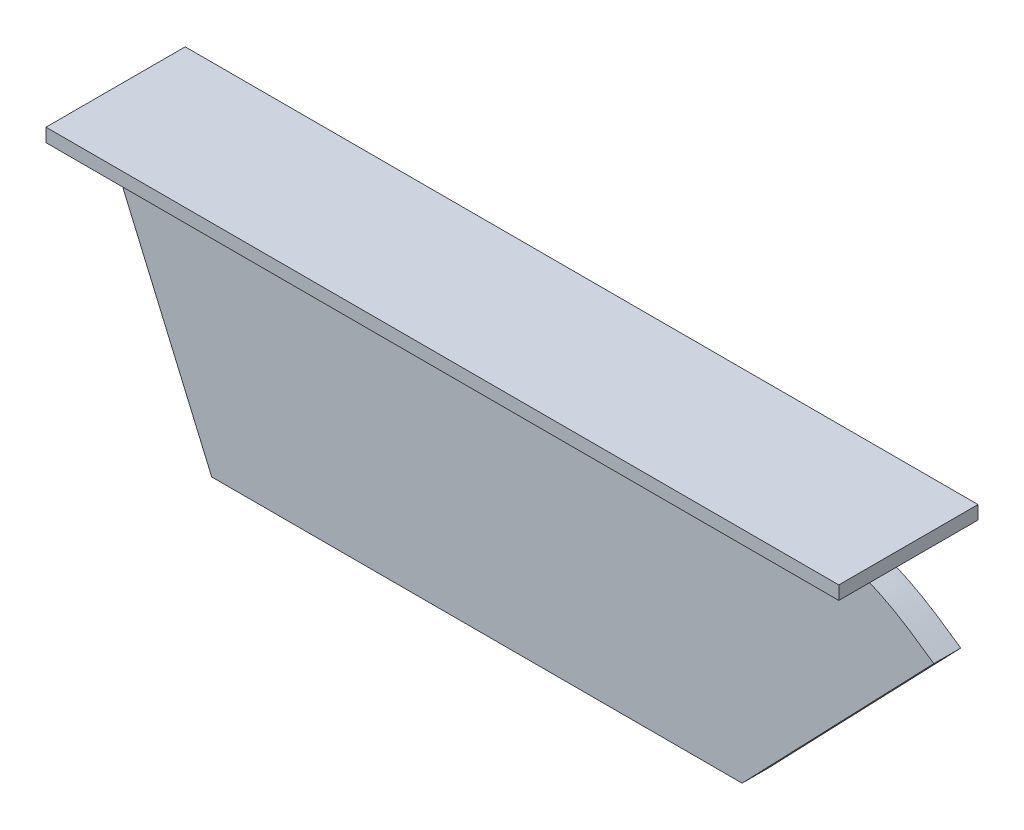
from build123d import *

# Parameters (mm, degrees)
EXTRUDE_1_DEPTH     = 1.2
CUT_EXTRUDE_START   = -1.2
CUT_EXTRUDE_1_DEPTH = 1.2
SKETCH_4_R          = 0.3
EXTRUDE_2_DEPTH     = 0.3
SKETCH_5_W          = 35.331764914
SKETCH_5_H          = 6.20328697
EXTRUDE_3_DEPTH     = 0.6


# Read off the part's stored shape, not the designer's step: Вырез-Вытянуть-Тонкостенный1
with BuildPart() as part:
    # Эскиз2 → Бобышка-Вытянуть1 (new body)
    with BuildSketch(Plane.XY):
        with BuildLine():
            Line((-18.718376773, 5.964639596), (-19.098029559, 5.834924894))
            Line((-19.098029559, 5.834924894), (-13.908113328, -6.217213911))
            Line((-13.908113328, -6.217213911), (10.163695982, -6.217213911))
            Line((10.163695982, -6.217213911), (19.098029559, 3.075246962))
            Line((19.098029559, 3.075246962), (18.818052215, 3.361181271))
            add(Edge.make_bspline(
                [(18.818052215, 3.361181271), (18.196335672, 3.797817809), (16.975433986, 4.6552669), (14.927683514, 5.553251977), (12.774537573, 6.124349252), (11.289757629, 6.1860932), (10.541386196, 6.217213911)],
                knots=[0, 0, 0, 0, 0.255164744, 0.501082157, 0.74853118, 1, 1, 1, 1], degree=3))
            Line((10.541386196, 6.217213911), (-16.231491208, 6.217213911))
            Line((-16.231491208, 6.217213911), (-18.718376773, 5.964639596))
        make_face()
    extrude(amount=EXTRUDE_1_DEPTH)

    # Вырез-Вытянуть-Тонкостенный1 outline → Вырез-Вытянуть-Тонкостенный1 (cut)
    with BuildSketch(Plane.XY.offset(1.2).offset(CUT_EXTRUDE_START)):
        with BuildLine():
            Line((19.098029559, 3.075246962), (18.818052215, 3.361181271))
            add(Edge.make_bspline(
                [(18.818052215, 3.361181271), (18.196335672, 3.797817809), (16.975433986, 4.6552669), (14.927683514, 5.553251977), (12.774537573, 6.124349252), (11.289757629, 6.1860932), (10.541386196, 6.217213911)],
                knots=[0, 0, 0, 0, 0.255164744, 0.501082157, 0.74853118, 1, 1, 1, 1], degree=3))
            Line((10.541386196, 6.217213911), (-16.231491208, 6.217213911))
            Line((-16.231491208, 6.217213911), (-18.718376773, 5.964639596))
            Line((-18.718376773, 5.964639596), (-19.098029559, 5.834924894))
            Line((-19.098029559, 5.834924894), (-13.908113328, -6.217213911))
            Line((-13.908113328, -6.217213911), (10.163695982, -6.217213911))
            Line((10.163695982, -6.217213911), (19.098029559, 3.075246962))
        make_face()
        with BuildLine():
            add(Edge.make_bspline(
                [(18.537521774, 3.069405939), (17.947435083, 3.483762917), (17.356771233, 3.89722808), (16.097834512, 4.604238585), (15.441178256, 4.89047439), (14.096932161, 5.359287166), (13.40761017, 5.542927998), (11.977353684, 5.757866724), (11.254825306, 5.787199054), (10.533072773, 5.817213911)],
                knots=[0, 0, 0, 0, 0.25, 0.25, 0.5, 0.5, 0.75, 0.75, 1, 1, 1, 1], degree=3))
            Line((18.537521774, 3.069405939), (9.993388288, -5.817213911))
            Line((9.993388288, -5.817213911), (-13.644851339, -5.817213911))
            Line((-13.644851339, -5.817213911), (-18.552496655, 5.5794291))
            Line((-18.552496655, 5.5794291), (-16.21123082, 5.817213911))
            Line((-16.21123082, 5.817213911), (10.533072773, 5.817213911))
        make_face(mode=Mode.SUBTRACT)
    extrude(amount=CUT_EXTRUDE_1_DEPTH, mode=Mode.SUBTRACT)

    # Эскиз4 → Бобышка-Вытянуть2 (add)
    with BuildSketch(Plane(origin=(0, 5.817213911, 0), x_dir=(1, 0, 0), z_dir=(0, 1, 0))):
        with Locations(Location((-15.91123082, -0.6, 0), (0, 0, 180))):
            Circle(SKETCH_4_R)
        with Locations(Location((-7.21123082, -0.6, 0), (0, 0, 270))):
            Circle(SKETCH_4_R)
        with Locations(Location((1.48876918, -0.6, 0), (0, 0, 270))):
            Circle(SKETCH_4_R)
        with Locations(Location((10.18876918, -0.6, 0), (0, 0, 270))):
            Circle(SKETCH_4_R)
    extrude(amount=EXTRUDE_2_DEPTH)

    # Эскиз5 → Бобышка-Вытянуть3 (add)
    with BuildSketch(Plane(origin=(0, 6.117213911, 0), x_dir=(1, 0, 0), z_dir=(0, 1, 0))):
        with Locations((-0.636806408, -0.824756774)):
            Rectangle(SKETCH_5_W, SKETCH_5_H)
    extrude(amount=EXTRUDE_3_DEPTH)


solid = part.part
